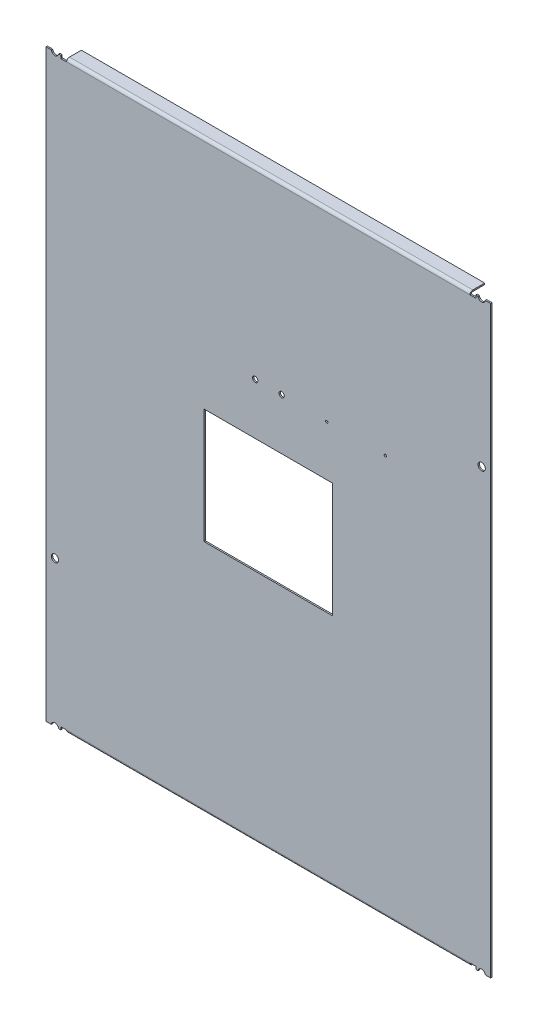
from build123d import *

# Parameters (mm, degrees)
CROQUIS1_W                   = 482.6
CROQUIS1_H                   = 634.238
BRIDA_BASE1_DEPTH            = 1.524
CROQUIS6_R                   = 3.9624
CROQUIS6_W                   = 6.35
CROQUIS6_H                   = 3.048
CORTAR_EXTRUIR1_DEPTH        = 399.487732229
BRIDA_START                  = -218.948
BRIDA_DE_ARISTA1_DEPTH       = 437.896
BRIDA_START_2                = -219.1004
BRIDA_DE_ARISTA1_2_OUTLINE_W = 0.1524
BRIDA_DE_ARISTA1_2_OUTLINE_H = 1.524
BRIDA_DE_ARISTA1_2_DEPTH     = 0.1524
BRIDA_START_3                = 218.948
BRIDA_DE_ARISTA1_3_OUTLINE_W = 0.1524
BRIDA_DE_ARISTA1_3_OUTLINE_H = 1.524
BRIDA_DE_ARISTA1_3_DEPTH     = 0.1524
BRIDA_DE_ARISTA1_4_DEPTH     = 437.896
CORTAR_EXTRUIR2_REACH        = 400.806
CROQUIS13_R                  = 3.9624
CROQUIS13_R_2                = 2.8956
CROQUIS13_R_3                = 1.27
CROQUIS13_W                  = 139.7
CROQUIS13_H                  = 124.714


# Read off the part's stored shape, not the designer's step: Brida de arista1
# Sheet-metal steps are written as plain solids
with BuildPart() as part:
    # Croquis1 → Brida base1 (new body)
    with BuildSketch(Plane.XY):
        Rectangle(CROQUIS1_W, CROQUIS1_H)
    extrude(amount=-BRIDA_BASE1_DEPTH)

    # Croquis6 → Cortar-Extruir1 (cut, through all)
    with BuildSketch(Plane.XY):
        with Locations((231.648, 317.627)):
            Circle(CROQUIS6_R)
        with Locations((-231.648, 317.627)):
            Circle(CROQUIS6_R)
        with Locations((-231.648, -317.627)):
            Circle(CROQUIS6_R)
        with Locations((231.648, -317.627)):
            Circle(CROQUIS6_R)
        with Locations((-222.123, 315.595)):
            Rectangle(CROQUIS6_W, CROQUIS6_H)
        with Locations((222.123, 315.595)):
            Rectangle(CROQUIS6_W, CROQUIS6_H)
        with Locations((-222.123, -315.595)):
            Rectangle(CROQUIS6_W, CROQUIS6_H)
        with Locations((222.123, -315.595)):
            Rectangle(CROQUIS6_W, CROQUIS6_H)
    extrude(amount=-CORTAR_EXTRUIR1_DEPTH, mode=Mode.SUBTRACT)

    # Brida de arista1 outline → Brida de arista1 (cut)
    with BuildSketch(Plane.YZ.offset(BRIDA_START)):
        with BuildLine():
            ThreePointArc((-316.710645431, -1.524), (-315.595, -0.408354569), (-314.071, 0))
            Line((-314.071, 0), (-317.119, 0))
            Line((-317.119, 0), (-317.119, -1.524))
            Line((-317.119, -1.524), (-316.710645431, -1.524))
        make_face()
        with BuildLine():
            Line((317.119, 0), (314.071, 0))
            ThreePointArc((314.071, 0), (315.595, -0.408354569), (316.710645431, -1.524))
            Line((316.710645431, -1.524), (317.119, -1.524))
            Line((317.119, -1.524), (317.119, 0))
        make_face()
    extrude(amount=BRIDA_DE_ARISTA1_DEPTH, mode=Mode.SUBTRACT)

    # Brida de arista1 2 outline → Brida de arista1 2 (cut)
    with BuildSketch(Plane.YZ.offset(BRIDA_START_2)):
        with Locations((-313.9948, -0.762)):
            Rectangle(BRIDA_DE_ARISTA1_2_OUTLINE_W, BRIDA_DE_ARISTA1_2_OUTLINE_H)
        with Locations((313.9948, -0.762)):
            Rectangle(BRIDA_DE_ARISTA1_2_OUTLINE_W, BRIDA_DE_ARISTA1_2_OUTLINE_H)
    extrude(amount=BRIDA_DE_ARISTA1_2_DEPTH, mode=Mode.SUBTRACT)

    # Brida de arista1 3 outline → Brida de arista1 3 (cut)
    with BuildSketch(Plane.YZ.offset(BRIDA_START_3)):
        with Locations((-313.9948, -0.762)):
            Rectangle(BRIDA_DE_ARISTA1_3_OUTLINE_W, BRIDA_DE_ARISTA1_3_OUTLINE_H)
        with Locations((313.9948, -0.762)):
            Rectangle(BRIDA_DE_ARISTA1_3_OUTLINE_W, BRIDA_DE_ARISTA1_3_OUTLINE_H)
    extrude(amount=BRIDA_DE_ARISTA1_3_DEPTH, mode=Mode.SUBTRACT)

    # Brida de arista1 4 outline → Brida de arista1 4 (add)
    with BuildSketch(Plane.YZ.offset(BRIDA_START)):
        with BuildLine():
            ThreePointArc((-315.595, -3.048), (-315.148630735, -1.970369265), (-314.071, -1.524))
            Line((-314.071, -1.524), (-316.710645431, -1.524))
            ThreePointArc((-316.710645431, -1.524), (-317.015141918, -2.259119551), (-317.119, -3.048))
            Line((-317.119, -3.048), (-317.119, -16.002))
            Line((-317.119, -16.002), (-315.595, -16.002))
            Line((-315.595, -16.002), (-315.595, -3.048))
        make_face()
        with BuildLine():
            Line((316.710645431, -1.524), (314.071, -1.524))
            ThreePointArc((314.071, -1.524), (315.148630735, -1.970369265), (315.595, -3.048))
            Line((315.595, -3.048), (315.595, -16.002))
            Line((315.595, -16.002), (317.119, -16.002))
            Line((317.119, -16.002), (317.119, -3.048))
            ThreePointArc((317.119, -3.048), (317.015141918, -2.259119551), (316.710645431, -1.524))
        make_face()
    extrude(amount=BRIDA_DE_ARISTA1_4_DEPTH)

    # Croquis13 → Cortar-Extruir2 (cut, up to next)
    with BuildSketch(Plane.XY, mode=Mode.PRIVATE) as cortar_extruir2_sk1:
        with Locations((-231.648, -158.877)):
            Circle(CROQUIS13_R)
    cortar_extruir2_tool1 = extrude(cortar_extruir2_sk1.sketch, amount=-CORTAR_EXTRUIR2_REACH, mode=Mode.PRIVATE) & part.part
    # Croquis13 → Cortar-Extruir2 (cut, up to next)
    with BuildSketch(Plane.XY, mode=Mode.PRIVATE) as cortar_extruir2_sk2:
        with Locations((231.648, 158.877)):
            Circle(CROQUIS13_R)
    cortar_extruir2_tool2 = extrude(cortar_extruir2_sk2.sketch, amount=-CORTAR_EXTRUIR2_REACH, mode=Mode.PRIVATE) & part.part
    # Croquis13 → Cortar-Extruir2 (cut, up to next)
    with BuildSketch(Plane.XY, mode=Mode.PRIVATE) as cortar_extruir2_sk3:
        with Locations((-14.224, 117.983)):
            Circle(CROQUIS13_R_2)
    cortar_extruir2_tool3 = extrude(cortar_extruir2_sk3.sketch, amount=-CORTAR_EXTRUIR2_REACH, mode=Mode.PRIVATE) & part.part
    # Croquis13 → Cortar-Extruir2 (cut, up to next)
    with BuildSketch(Plane.XY, mode=Mode.PRIVATE) as cortar_extruir2_sk4:
        with Locations((63.5, 116.967)):
            Circle(CROQUIS13_R_3)
    cortar_extruir2_tool4 = extrude(cortar_extruir2_sk4.sketch, amount=-CORTAR_EXTRUIR2_REACH, mode=Mode.PRIVATE) & part.part
    # Croquis13 → Cortar-Extruir2 (cut, up to next)
    with BuildSketch(Plane.XY, mode=Mode.PRIVATE) as cortar_extruir2_sk5:
        with Locations((14.478, 117.983)):
            Circle(CROQUIS13_R_2)
    cortar_extruir2_tool5 = extrude(cortar_extruir2_sk5.sketch, amount=-CORTAR_EXTRUIR2_REACH, mode=Mode.PRIVATE) & part.part
    # Croquis13 → Cortar-Extruir2 (cut, up to next)
    with BuildSketch(Plane.XY, mode=Mode.PRIVATE) as cortar_extruir2_sk6:
        with Locations((127, 116.967)):
            Circle(CROQUIS13_R_3)
    cortar_extruir2_tool6 = extrude(cortar_extruir2_sk6.sketch, amount=-CORTAR_EXTRUIR2_REACH, mode=Mode.PRIVATE) & part.part
    # Croquis13 → Cortar-Extruir2 (cut, up to next)
    with BuildSketch(Plane.XY, mode=Mode.PRIVATE) as cortar_extruir2_sk7:
        Rectangle(CROQUIS13_W, CROQUIS13_H)
    cortar_extruir2_tool7 = extrude(cortar_extruir2_sk7.sketch, amount=-CORTAR_EXTRUIR2_REACH, mode=Mode.PRIVATE) & part.part
    add(cortar_extruir2_tool1.solids().sort_by_distance((-231.648, -158.877, 0))[0], mode=Mode.SUBTRACT)
    add(cortar_extruir2_tool2.solids().sort_by_distance((231.648, 158.877, 0))[0], mode=Mode.SUBTRACT)
    add(cortar_extruir2_tool3.solids().sort_by_distance((-14.224, 117.983, 0))[0], mode=Mode.SUBTRACT)
    add(cortar_extruir2_tool4.solids().sort_by_distance((63.5, 116.967, 0))[0], mode=Mode.SUBTRACT)
    add(cortar_extruir2_tool5.solids().sort_by_distance((14.478, 117.983, 0))[0], mode=Mode.SUBTRACT)
    add(cortar_extruir2_tool6.solids().sort_by_distance((127, 116.967, 0))[0], mode=Mode.SUBTRACT)
    add(cortar_extruir2_tool7.solids().sort_by_distance((0, 0, 0))[0], mode=Mode.SUBTRACT)


solid = part.part
